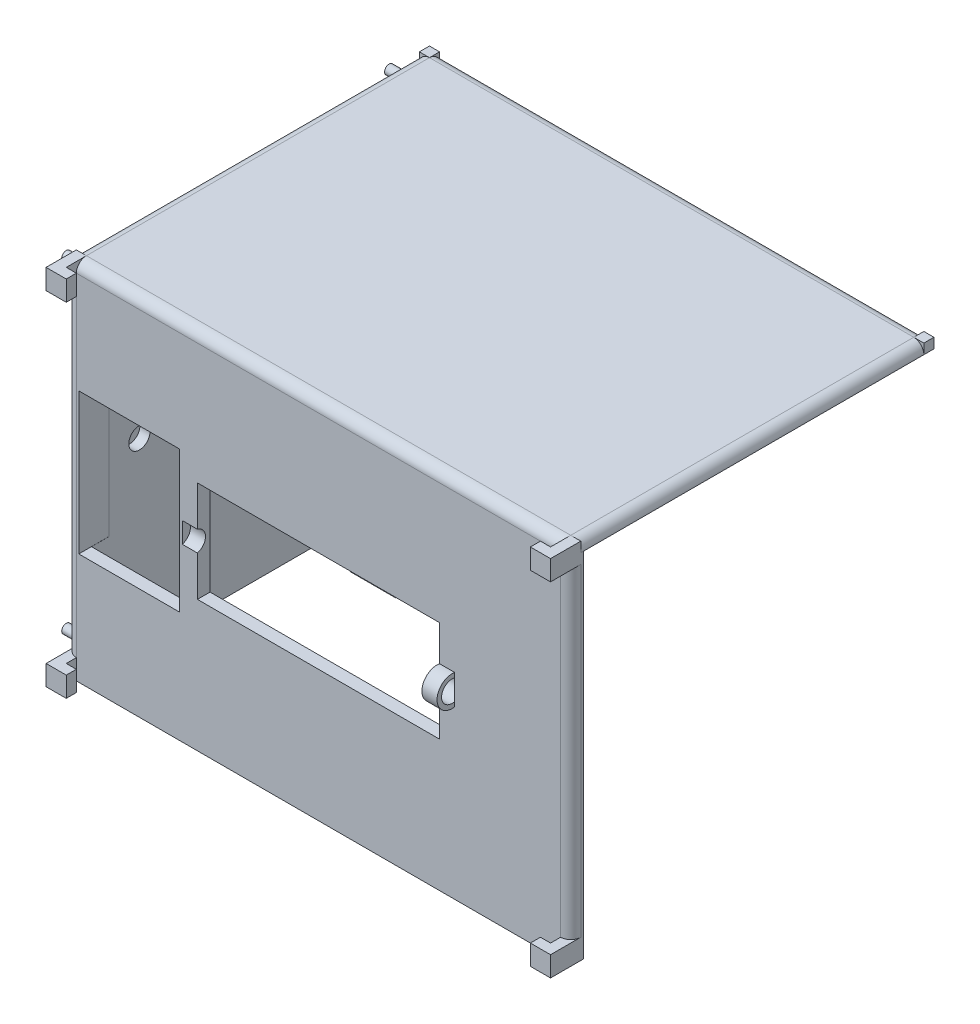
from build123d import *

# Parameters (mm, degrees)
SKETCH1_W            = 127
SKETCH1_H            = 91.44
BOSS_EXTRUDE1_DEPTH  = 228.6
SKETCH3_W            = 120.65
SKETCH3_H            = 85.09
CUT_EXTRUDE1_DEPTH   = 226.06
SKETCH2_R            = 2.667
CUT_EXTRUDE2_DEPTH   = 266.475570251
SKETCH4_R            = 1.143
BOSS_EXTRUDE3_DEPTH  = 5.08
SKETCH5_R            = 20.32
CUT_EXTRUDE3_DEPTH   = 1.27
FILLET1_R            = 0.762
FILLET2_R            = 0.762
FILLET3_R            = 0.762
SKETCH6_W            = 60.96
SKETCH6_H            = 25.4
CUT_EXTRUDE4_DEPTH   = 256.582569828
FILLET4_R            = 2.54
SKETCH7_W            = 85.09
SKETCH7_H            = 111.152565629
CUT_EXTRUDE5_DEPTH   = 268.942913323
SKETCH10_R           = 2.667
CUT_EXTRUDE6_DEPTH   = 2.54
CUT_EXTRUDE7_DEPTH   = 7.62
SKETCH13_R           = 2.667
CUT_EXTRUDE8_DEPTH   = 2.54
CUT_EXTRUDE9_DEPTH   = 7.62
SKETCH20_W           = 11.43
SKETCH20_H           = 7.62
BOSS_EXTRUDE4_DEPTH  = 50.8
CUT_EXTRUDE10_START  = -12.7
SKETCH21_R           = 2.667
CUT_EXTRUDE10_DEPTH  = 12.7
CUT_EXTRUDE11_DEPTH  = 12.7
SKETCH24_R           = 3.81
BOSS_EXTRUDE5_DEPTH  = 3.81
SKETCH25_R           = 2.667
CUT_EXTRUDE12_DEPTH  = 3.81
CUT_EXTRUDE13_DEPTH  = 12.7
CUT_EXTRUDE14_START  = 64.77
SKETCH27_R           = 2.667
CUT_EXTRUDE14_DEPTH  = 64.77
CUT_EXTRUDE15_START  = 64.77
SKETCH29_R           = 2.667
CUT_EXTRUDE15_DEPTH  = 64.77
FILLET6_R            = 50.8
FILLET7_R            = 50.8
BOSS_EXTRUDE6_DEPTH  = 5.08
MIRROR5_COPY_1_DEPTH = 5.08
MIRROR6_COPY_1_DEPTH = 5.08
MIRROR6_COPY_2_DEPTH = 5.08
MIRROR6_COPY_3_DEPTH = 5.08
SKETCH35_W           = 127
SKETCH35_H           = 137.16
CUT_EXTRUDE16_DEPTH  = 52.07
SKETCH39_W           = 85.09
SKETCH39_H           = 88.9
CUT_EXTRUDE20_DEPTH  = 52.07
SKETCH41_W           = 123.825
SKETCH41_H           = 88.9
CUT_EXTRUDE21_DEPTH  = 52.07
SKETCH42_W           = 127
SKETCH42_H           = 5.08
CUT_EXTRUDE22_DEPTH  = 236.22


with BuildPart() as part:
    # Sketch1 → Boss-Extrude1 (new body)
    with BuildSketch(Plane(origin=(0, 0, 0), x_dir=(1, 0, 0), z_dir=(0, 1, 0))):
        Rectangle(SKETCH1_W, SKETCH1_H)
    extrude(amount=BOSS_EXTRUDE1_DEPTH)

    # Sketch3 → Cut-Extrude1 (cut)
    with BuildSketch(Plane.XZ):
        Rectangle(SKETCH3_W, SKETCH3_H)
    extrude(amount=-CUT_EXTRUDE1_DEPTH, mode=Mode.SUBTRACT)

    # Sketch2 → Cut-Extrude2 (cut, through all)
    with BuildSketch(Plane(origin=(63.5, 0, 0), x_dir=(0, 0, -1), z_dir=(1, 0, 0))):
        with Locations((0, 182.88)):
            Circle(SKETCH2_R)
    extrude(amount=-CUT_EXTRUDE2_DEPTH, mode=Mode.SUBTRACT)

    # Sketch4 → Boss-Extrude3 (add)
    with BuildSketch(Plane(origin=(63.5, 0, 0), x_dir=(0, 0, -1), z_dir=(1, 0, 0))):
        with Locations(Location((-40.64, 223.52, 0), (0, 0, 180))):
            Circle(SKETCH4_R)
        with Locations(Location((40.64, 223.52, 0), (0, 0, 180))):
            Circle(SKETCH4_R)
        with Locations(Location((40.64, 142.24, 0), (0, 0, 180))):
            Circle(SKETCH4_R)
        with Locations(Location((-40.64, 142.24, 0), (0, 0, 180))):
            Circle(SKETCH4_R)
    boss_extrude3 = extrude(amount=BOSS_EXTRUDE3_DEPTH)

    # Sketch5 → Cut-Extrude3 (cut)
    with BuildSketch(Plane.ZY.offset(-60.325)):
        with Locations((0, 182.88)):
            Circle(SKETCH5_R)
    cut_extrude3 = extrude(amount=-CUT_EXTRUDE3_DEPTH, mode=Mode.SUBTRACT)

    # Fillet1
    fillet1_edges = [part.edges().sort_by_distance(p)[0] for p in [
        (61.595, 182.88, 2.667),
    ]]
    fillet(fillet1_edges, radius=FILLET1_R)

    # Fillet2
    fillet2_edges = [part.edges().sort_by_distance(p)[0] for p in [
        (63.5, 182.88, 2.667),
    ]]
    fillet(fillet2_edges, radius=FILLET2_R)

    # Mirror2: Boss-Extrude3, Cut-Extrude3 across plane
    add(boss_extrude3.mirror(Plane(origin=(0, 0, 0), x_dir=(0, 0, 1), z_dir=(1, 0, 0))))
    add(cut_extrude3.mirror(Plane(origin=(0, 0, 0), x_dir=(0, 0, 1), z_dir=(1, 0, 0))), mode=Mode.SUBTRACT)

    # Fillet3
    fillet3_edges = [part.edges().sort_by_distance(p)[0] for p in [
        (-63.5, 182.88, 2.667),
        (-61.595, 182.88, 2.667),
    ]]
    fillet(fillet3_edges, radius=FILLET3_R)

    # Sketch6 → Cut-Extrude4 (cut, through all)
    with BuildSketch(Plane.XY.offset(45.72)):
        with Locations((0, 182.88)):
            Rectangle(SKETCH6_W, SKETCH6_H)
    extrude(amount=-CUT_EXTRUDE4_DEPTH, mode=Mode.SUBTRACT)

    # Fillet4
    fillet4_edges = [part.edges().sort_by_distance(p)[0] for p in [
        (-63.5, 228.6, 0),
        (0, 228.6, 45.72),
        (63.5, 228.6, 0),
        (63.5, 114.3, 45.72),
        (-63.5, 114.3, 45.72),
        (-63.5, 114.3, -45.72),
        (63.5, 114.3, -45.72),
        (0, 228.6, -45.72),
    ]]
    fillet(fillet4_edges, radius=FILLET4_R)

    # Sketch7 → Cut-Extrude5 (cut, through all)
    with BuildSketch(Plane(origin=(63.5, 0, 0), x_dir=(0, 0, -1), z_dir=(1, 0, 0))):
        with Locations((0, 75.896282814)):
            Rectangle(SKETCH7_W, SKETCH7_H)
    extrude(amount=-CUT_EXTRUDE5_DEPTH, mode=Mode.SUBTRACT)

    # Sketch10 → Cut-Extrude6 (cut)
    with BuildSketch(Plane.ZY.offset(-60.325)):
        with Locations((-30.48, 182.88)):
            Circle(SKETCH10_R)
    extrude(amount=-CUT_EXTRUDE6_DEPTH, mode=Mode.SUBTRACT)

    # Sketch12 → Cut-Extrude7 (cut)
    with BuildSketch(Plane(origin=(0, 0, -45.72), x_dir=(-1, 0, 0), z_dir=(0, 0, -1))):
        Polygon((-34.810362372, 182.807903476), (-34.810362372, 200.587903476), (-60.210362372, 200.587903476), (-60.210362372, 182.807903476), (-60.210362372, 165.027903476), (-34.810362372, 165.027903476), align=None)
    extrude(amount=-CUT_EXTRUDE7_DEPTH, mode=Mode.SUBTRACT)

    # Sketch13 → Cut-Extrude8 (cut)
    with BuildSketch(Plane(origin=(-60.325, 0, 0), x_dir=(0, 0, -1), z_dir=(1, 0, 0))):
        with Locations((-30.48, 182.88)):
            Circle(SKETCH13_R)
    extrude(amount=-CUT_EXTRUDE8_DEPTH, mode=Mode.SUBTRACT)

    # Sketch16 → Cut-Extrude9 (cut)
    with BuildSketch(Plane.XY.offset(45.72)):
        Polygon((-60.34639287, 182.934228321), (-60.34639287, 200.714228321), (-34.94639287, 200.714228321), (-34.94639287, 165.154228321), (-60.34639287, 165.154228321), align=None)
    extrude(amount=-CUT_EXTRUDE9_DEPTH, mode=Mode.SUBTRACT)

    # Sketch20 → Boss-Extrude4 (add)
    with BuildSketch(Plane.XZ.offset(-226.06)):
        with Locations((1.27, -30.48)):
            Rectangle(SKETCH20_W, SKETCH20_H)
    boss_extrude4 = extrude(amount=BOSS_EXTRUDE4_DEPTH)

    # Sketch21 → Cut-Extrude10 (cut)
    with BuildSketch(Plane(origin=(6.985, 0, 0), x_dir=(0, 0, -1), z_dir=(1, 0, 0)).offset(CUT_EXTRUDE10_START)):
        with Locations(Location((30.48, 182.88, 0), (0, 0, 180))):
            Circle(SKETCH21_R)
    cut_extrude10 = extrude(amount=CUT_EXTRUDE10_DEPTH, mode=Mode.SUBTRACT)

    # Sketch23 → Cut-Extrude11 (cut)
    with BuildSketch(Plane(origin=(6.985, 0, 0), x_dir=(0, 0, -1), z_dir=(1, 0, 0))):
        Polygon((27.813, 182.88), (26.67, 182.88), (26.67, 175.26), (34.29, 175.26), (34.29, 182.88), align=None)
    extrude(amount=-CUT_EXTRUDE11_DEPTH, mode=Mode.SUBTRACT)

    # Sketch24 → Boss-Extrude5 (add)
    with BuildSketch(Plane.ZY.offset(-30.48)):
        with Locations((-46.355, 182.88)):
            Circle(SKETCH24_R)
    boss_extrude5 = extrude(amount=-BOSS_EXTRUDE5_DEPTH)

    # Sketch25 → Cut-Extrude12 (cut)
    with BuildSketch(Plane.ZY.offset(-30.48)):
        with Locations((-46.355, 182.88)):
            Circle(SKETCH25_R)
    cut_extrude12 = extrude(amount=-CUT_EXTRUDE12_DEPTH, mode=Mode.SUBTRACT)

    # Mirror3: Boss-Extrude4, Cut-Extrude10, Boss-Extrude5, Cut-Extrude12 across plane
    add(boss_extrude4.mirror(Plane.XY))
    add(cut_extrude10.mirror(Plane.XY), mode=Mode.SUBTRACT)
    add(boss_extrude5.mirror(Plane.XY))
    add(cut_extrude12.mirror(Plane.XY), mode=Mode.SUBTRACT)

    # Sketch26 → Cut-Extrude13 (cut)
    with BuildSketch(Plane(origin=(6.985, 0, 0), x_dir=(0, 0, -1), z_dir=(1, 0, 0))):
        Polygon((-27.813, 182.88), (-26.67, 182.88), (-26.67, 175.26), (-34.29, 175.26), (-34.29, 182.88), align=None)
    extrude(amount=-CUT_EXTRUDE13_DEPTH, mode=Mode.SUBTRACT)

    # Sketch27 → Cut-Extrude14 (cut)
    with BuildSketch(Plane.ZY.offset(-30.48).offset(CUT_EXTRUDE14_START)):
        with Locations((-46.355, 182.88)):
            Circle(SKETCH27_R)
    extrude(amount=-CUT_EXTRUDE14_DEPTH, mode=Mode.SUBTRACT)

    # Sketch29 → Cut-Extrude15 (cut)
    with BuildSketch(Plane.ZY.offset(-30.48).offset(CUT_EXTRUDE15_START)):
        with Locations(Location((46.355, 182.88, 0), (0, 0, 256.225853002))):
            Circle(SKETCH29_R)
    extrude(amount=-CUT_EXTRUDE15_DEPTH, mode=Mode.SUBTRACT)

    # Fillet6
    # the kernel refuses this fillet: 50.8 mm, written as the material it takes off along each edge
    with BuildSketch(Plane(origin=(33.773797915, 182.88, 34.29), x_dir=(0, 0, -1), z_dir=(-1, 0, 0))) as fillet6_piece_1:
        with BuildLine():
            CenterArc((50.8, -10.715519166), FILLET6_R, 167.822824326, 12.177175674)
            Line((0, -10.715519166), (-1.016, -10.715519166))
            Line((-1.016, -10.715519166), (-1.016, 0))
            Line((-1.016, 0), (0, 1.016))
            ThreePointArc((0, 1.016), (0.5715, 1.016), (0.14986, 0.214310383))
            Line((0.14986, 0.214310383), (1.143, 0))
        make_face()
    extrude(amount=65.007595831, mode=Mode.SUBTRACT)

    # Fillet7
    # the kernel refuses this fillet: 50.8 mm, written as the material it takes off along each edge
    with BuildSketch(Plane(origin=(33.773797915, 182.88, -34.29), x_dir=(0, 1, 0), z_dir=(-1, 0, 0))) as fillet7_piece_1:
        with BuildLine():
            CenterArc((10.715519166, -50.8), FILLET7_R, 90, 12.177175674)
            Line((0, -1.143), (0, 0))
            Line((0, 0), (10.715519166, 0))
        make_face()
    extrude(amount=65.007595831, mode=Mode.SUBTRACT)

    # Sketch33 → Boss-Extrude6 (add)
    with BuildSketch(Plane(origin=(0, 228.6, 0), x_dir=(1, 0, 0), z_dir=(0, 1, 0))):
        Polygon((63.5, 43.18), (63.5, 50.8), (58.42, 50.8), (58.42, 48.26), (60.96, 48.26), (60.96, 43.18), align=None)
    boss_extrude6 = extrude(amount=-BOSS_EXTRUDE6_DEPTH)

    # Mirror4: Boss-Extrude6 across plane
    add(boss_extrude6.mirror(Plane(origin=(0, 0, 0), x_dir=(0, 0, 1), z_dir=(1, 0, 0))))

    # Mirror5: Boss-Extrude6 across plane
    add(boss_extrude6.mirror(Plane.ZX.offset(182.88)))

    # Mirror5 copy 1 sketch → Mirror5 copy 1 (add)
    with BuildSketch(Plane(origin=(0, 137.16, 0), x_dir=(-1, 0, 0), z_dir=(0, -1, 0))):
        Polygon((63.5, 43.18), (63.5, 50.8), (58.42, 50.8), (58.42, 48.26), (60.96, 48.26), (60.96, 43.18), align=None)
    extrude(amount=-MIRROR5_COPY_1_DEPTH)

    # Mirror6: Boss-Extrude6 across plane
    add(boss_extrude6.mirror(Plane.XY))

    # Mirror6 copy 1 sketch → Mirror6 copy 1 (add)
    with BuildSketch(Plane(origin=(0, 228.6, 0), x_dir=(-1, 0, 0), z_dir=(0, 1, 0))):
        Polygon((63.5, 43.18), (63.5, 50.8), (58.42, 50.8), (58.42, 48.26), (60.96, 48.26), (60.96, 43.18), align=None)
    extrude(amount=-MIRROR6_COPY_1_DEPTH)

    # Mirror6 copy 2 sketch → Mirror6 copy 2 (add)
    with BuildSketch(Plane.XZ.offset(-137.16)):
        Polygon((63.5, 43.18), (63.5, 50.8), (58.42, 50.8), (58.42, 48.26), (60.96, 48.26), (60.96, 43.18), align=None)
    extrude(amount=-MIRROR6_COPY_2_DEPTH)

    # Mirror6 copy 3 sketch → Mirror6 copy 3 (add)
    with BuildSketch(Plane(origin=(0, 137.16, 0), x_dir=(-1, 0, 0), z_dir=(0, -1, 0))):
        Polygon((63.5, -43.18), (63.5, -50.8), (58.42, -50.8), (58.42, -48.26), (60.96, -48.26), (60.96, -43.18), align=None)
    extrude(amount=-MIRROR6_COPY_3_DEPTH)

    # Sketch35 → Cut-Extrude16 (cut, symmetric)
    with BuildSketch(Plane.XY):
        with Locations((0, 68.58)):
            Rectangle(SKETCH35_W, SKETCH35_H)
    extrude(amount=CUT_EXTRUDE16_DEPTH, both=True, mode=Mode.SUBTRACT)

    # Sketch39 → Cut-Extrude20 (cut, symmetric)
    with BuildSketch(Plane(origin=(63.5, 0, 0), x_dir=(0, 0, -1), z_dir=(1, 0, 0))):
        with Locations((0, 181.61)):
            Rectangle(SKETCH39_W, SKETCH39_H)
    extrude(amount=CUT_EXTRUDE20_DEPTH, both=True, mode=Mode.SUBTRACT)

    # Sketch41 → Cut-Extrude21 (cut, symmetric)
    with BuildSketch(Plane(origin=(0, 0, -45.72), x_dir=(-1, 0, 0), z_dir=(0, 0, -1))):
        with Locations((-1.5875, 181.61)):
            Rectangle(SKETCH41_W, SKETCH41_H)
    extrude(amount=CUT_EXTRUDE21_DEPTH, both=True, mode=Mode.SUBTRACT)

    # Sketch42 → Cut-Extrude22 (cut)
    with BuildSketch(Plane(origin=(0, 0, 0), x_dir=(1, 0, 0), z_dir=(0, 1, 0))):
        with Locations((0, 48.26)):
            Rectangle(SKETCH42_W, SKETCH42_H)
    extrude(amount=CUT_EXTRUDE22_DEPTH, mode=Mode.SUBTRACT)


solid = part.part
